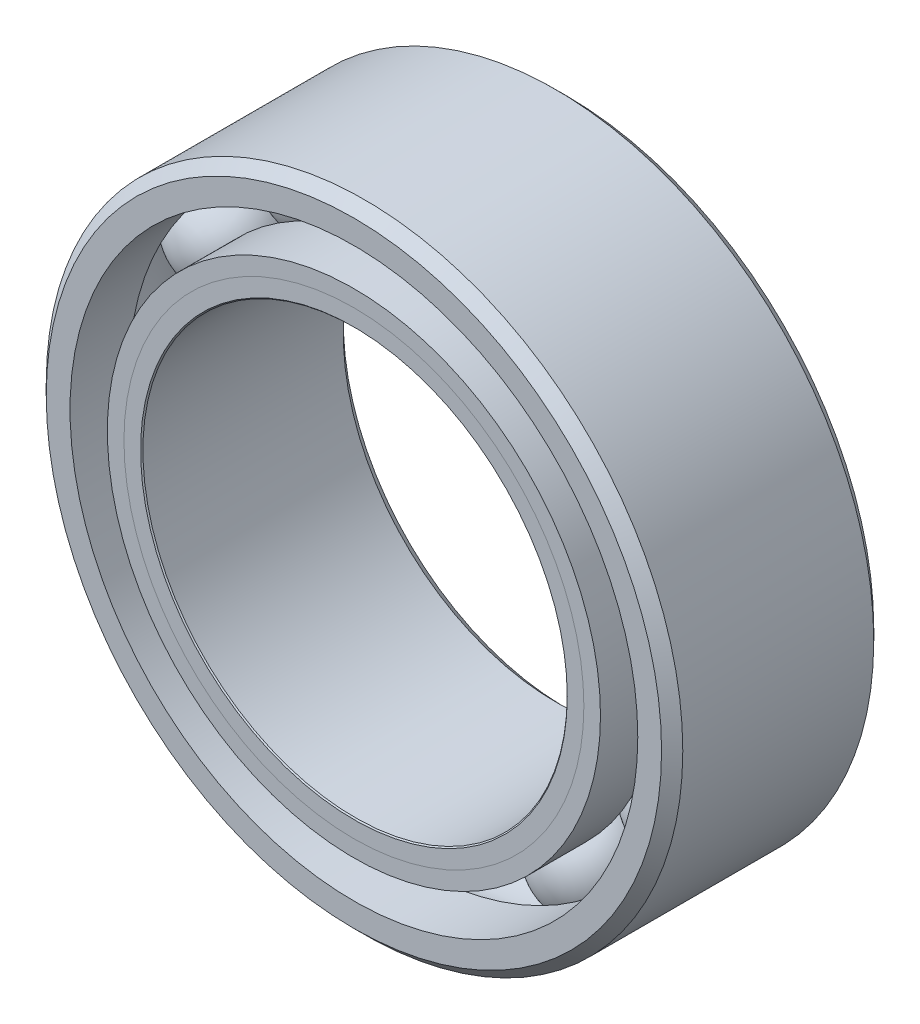
from build123d import *

# Parameters (mm, degrees)
CIRPATTERN1_COUNT = 12


with BuildPart() as part:
    # Sketch1 → Revolve1 (revolve)
    with BuildSketch(Plane(origin=(0, 0, 0), x_dir=(0, 0, -1), z_dir=(1, 0, 0))):
        with BuildLine():
            Line((1.42875, 4.7625), (-1.42875, 4.7625))
            Line((-1.42875, 4.7625), (-1.5875, 4.60375))
            Line((-1.5875, 4.60375), (-1.5875, 4.247870879))
            Line((-1.5875, 4.247870879), (-0.705555556, 4.247870879))
            ThreePointArc((-0.705555556, 4.247870879), (0, 4.727510244), (0.705555556, 4.247870879))
            Line((0.705555556, 4.247870879), (1.5875, 4.247870879))
            Line((1.5875, 4.247870879), (1.5875, 4.60375))
            Line((1.5875, 4.60375), (1.42875, 4.7625))
        make_face()
    revolve(axis=Axis((0, 0, 1.5875), (0, 0, -1)))


with BuildPart() as body_2:
    # Sketch2 → Revolve2 (revolve)
    with BuildSketch(Plane(origin=(0, 0, 0), x_dir=(0, 0, -1), z_dir=(1, 0, 0))):
        with BuildLine():
            Line((-1.5875, 3.689629121), (-0.705555556, 3.689629121))
            ThreePointArc((-0.705555556, 3.689629121), (-0.426574308, 3.341253811), (0, 3.209989756))
            Line((0, 3.209989756), (0, 3.192494878))
            Line((0, 3.192494878), (-1.338932879, 3.192494878))
            Line((-1.338932879, 3.192494878), (-1.5875, 3.441062))
            Line((-1.5875, 3.441062), (-1.5875, 3.689629121))
        make_face()
    revolve(axis=Axis((0, 0, 1.5875), (0, 0, -1)))


with BuildPart() as body_3:
    # Sketch3 → Revolve3 (revolve)
    with BuildSketch(Plane(origin=(0, 0, 0), x_dir=(0, 0, -1), z_dir=(1, 0, 0))):
        with BuildLine():
            Line((-1.5875, 3.441062), (-1.338932879, 3.192494878))
            Line((-1.338932879, 3.192494878), (0, 3.192494878))
            Line((0, 3.192494878), (0, 3.209989756))
            ThreePointArc((0, 3.209989756), (0.426574308, 3.341253811), (0.705555556, 3.689629121))
            Line((0.705555556, 3.689629121), (1.5875, 3.689629121))
            Line((1.5875, 3.689629121), (1.5875, 3.33375))
            Line((1.5875, 3.33375), (1.42875, 3.175))
            Line((1.42875, 3.175), (-1.570005122, 3.175))
            Line((-1.570005122, 3.175), (-1.5875, 3.192494878))
            Line((-1.5875, 3.192494878), (-1.5875, 3.441062))
        make_face()
    revolve(axis=Axis((0, 0, 1.5875), (0, 0, -1)))


with BuildPart() as body_4:
    # Sketch4 → Revolve4 (revolve)
    with BuildSketch(Plane(origin=(0, 0, 0), x_dir=(0, 0, -1), z_dir=(1, 0, 0))):
        with BuildLine():
            Line((-0.758760244, 3.96875), (0.758760244, 3.96875))
            ThreePointArc((0.758760244, 3.96875), (0, 4.727510244), (-0.758760244, 3.96875))
        make_face()
    revolve(axis=Axis((0, 3.96875, 0.758760244), (0, 0, -1)))


with BuildPart() as cirpattern1_1:
    # CirPattern1: pattern copy
    add(body_4.part.rotate(Axis((0, 0, -1.5875), (0, 0, 1)), 1 * 360 / CIRPATTERN1_COUNT))


with BuildPart() as cirpattern1_2:
    # CirPattern1: pattern copy
    add(body_4.part.rotate(Axis((0, 0, -1.5875), (0, 0, 1)), 2 * 360 / CIRPATTERN1_COUNT))


with BuildPart() as cirpattern1_3:
    # CirPattern1: pattern copy
    add(body_4.part.rotate(Axis((0, 0, -1.5875), (0, 0, 1)), 3 * 360 / CIRPATTERN1_COUNT))


with BuildPart() as cirpattern1_4:
    # CirPattern1: pattern copy
    add(body_4.part.rotate(Axis((0, 0, -1.5875), (0, 0, 1)), 4 * 360 / CIRPATTERN1_COUNT))


with BuildPart() as cirpattern1_5:
    # CirPattern1: pattern copy
    add(body_4.part.rotate(Axis((0, 0, -1.5875), (0, 0, 1)), 5 * 360 / CIRPATTERN1_COUNT))


with BuildPart() as cirpattern1_6:
    # CirPattern1: pattern copy
    add(body_4.part.rotate(Axis((0, 0, -1.5875), (0, 0, 1)), 6 * 360 / CIRPATTERN1_COUNT))


with BuildPart() as cirpattern1_7:
    # CirPattern1: pattern copy
    add(body_4.part.rotate(Axis((0, 0, -1.5875), (0, 0, 1)), 7 * 360 / CIRPATTERN1_COUNT))


with BuildPart() as cirpattern1_8:
    # CirPattern1: pattern copy
    add(body_4.part.rotate(Axis((0, 0, -1.5875), (0, 0, 1)), 8 * 360 / CIRPATTERN1_COUNT))


with BuildPart() as cirpattern1_9:
    # CirPattern1: pattern copy
    add(body_4.part.rotate(Axis((0, 0, -1.5875), (0, 0, 1)), 9 * 360 / CIRPATTERN1_COUNT))


with BuildPart() as cirpattern1_10:
    # CirPattern1: pattern copy
    add(body_4.part.rotate(Axis((0, 0, -1.5875), (0, 0, 1)), 10 * 360 / CIRPATTERN1_COUNT))


with BuildPart() as cirpattern1_11:
    # CirPattern1: pattern copy
    add(body_4.part.rotate(Axis((0, 0, -1.5875), (0, 0, 1)), 11 * 360 / CIRPATTERN1_COUNT))


solid = Compound([part.part, body_2.part, body_3.part, body_4.part, cirpattern1_1.part, cirpattern1_2.part, cirpattern1_3.part, cirpattern1_4.part, cirpattern1_5.part, cirpattern1_6.part, cirpattern1_7.part, cirpattern1_8.part, cirpattern1_9.part, cirpattern1_10.part, cirpattern1_11.part])
